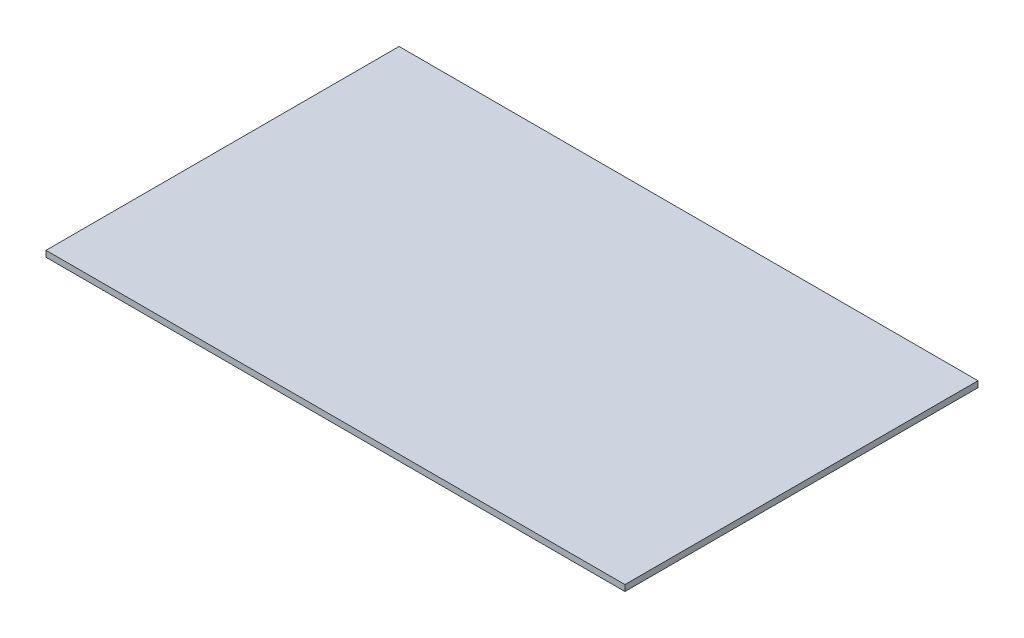
from build123d import *

# Parameters (mm, degrees)
SKETCH2_W           = 455
SKETCH2_H           = 4.7625
BOSS_EXTRUDE1_DEPTH = 277.48


with BuildPart() as part:
    # Sketch2 → Boss-Extrude1 (new body)
    with BuildSketch(Plane.XY):
        with Locations((227.5, 2.38125)):
            Rectangle(SKETCH2_W, SKETCH2_H)
    extrude(amount=BOSS_EXTRUDE1_DEPTH)


solid = part.part
